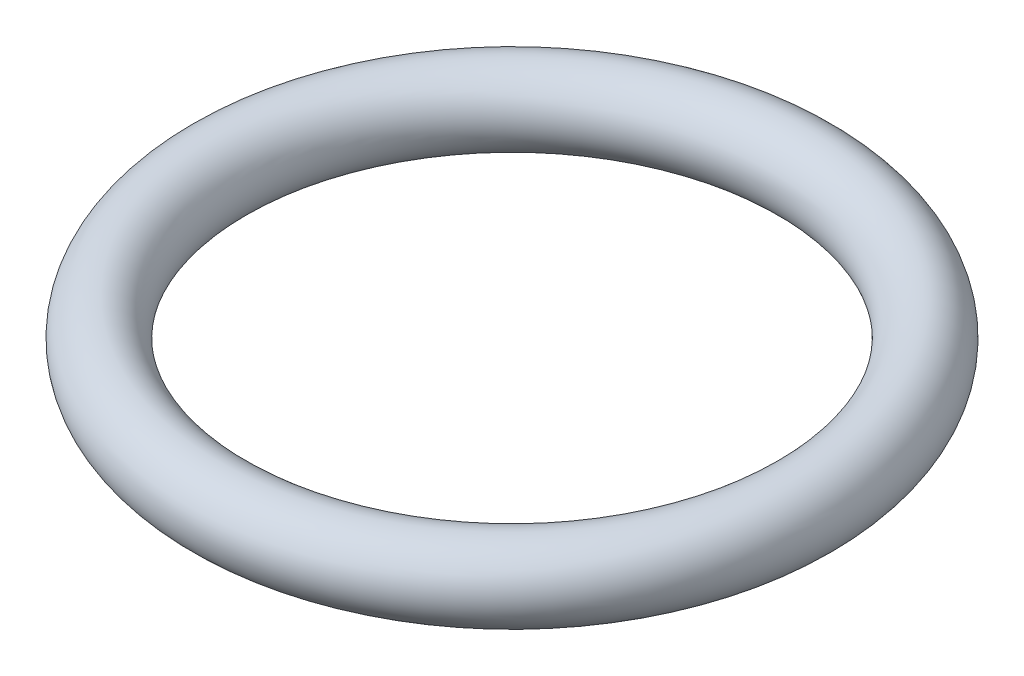
from build123d import *

# Parameters (mm, degrees)
SKETCH3_R = 5.245868117


with BuildPart() as part:
    # Sweep1: sweep along a path in Sketch1
    with BuildLine(Plane(origin=(0, 0, 0), x_dir=(1, 0, 0), z_dir=(0, 1, 0))) as sweep1_path:
        CenterArc((0, 0), 5, 0, 360)
    # Sketch3 → Sweep1 (sweep)
    with BuildSketch(Plane.XY):
        with Locations((41.009976123, -28.48087549)):
            Circle(SKETCH3_R)
    sweep(path=sweep1_path.line)


solid = part.part
